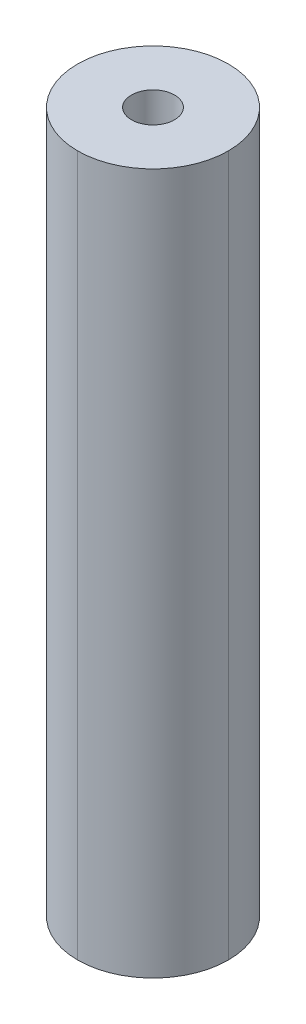
from build123d import *

# Parameters (mm, degrees)
SKETCH1_W           = 14
SKETCH1_H           = 14
BOSS_EXTRUDE2_DEPTH = 65.1
SKETCH2_R           = 2
CUT_EXTRUDE1_DEPTH  = 66.848386465
FILLET1_R           = 7


with BuildPart() as part:
    # Sketch1 → Boss-Extrude2 (new body)
    with BuildSketch(Plane(origin=(0, 0, 0), x_dir=(1, 0, 0), z_dir=(0, 1, 0))):
        Rectangle(SKETCH1_W, SKETCH1_H)
    extrude(amount=BOSS_EXTRUDE2_DEPTH)

    # Sketch2 → Cut-Extrude1 (cut, through all)
    with BuildSketch(Plane(origin=(0, 65.1, 0), x_dir=(1, 0, 0), z_dir=(0, 1, 0))):
        with Locations(Location((0, 0, 0), (0, 0, 270))):
            Circle(SKETCH2_R)
    extrude(amount=-CUT_EXTRUDE1_DEPTH, mode=Mode.SUBTRACT)

    # Fillet1
    fillet1_edges = [part.edges().sort_by_distance(p)[0] for p in [
        (-7, 32.55, 7),
        (-7, 32.55, -7),
        (7, 32.55, -7),
        (7, 32.55, 7),
    ]]
    fillet(fillet1_edges, radius=FILLET1_R - 0.0001)  # a hair under: the kernel refuses the full size


solid = part.part
